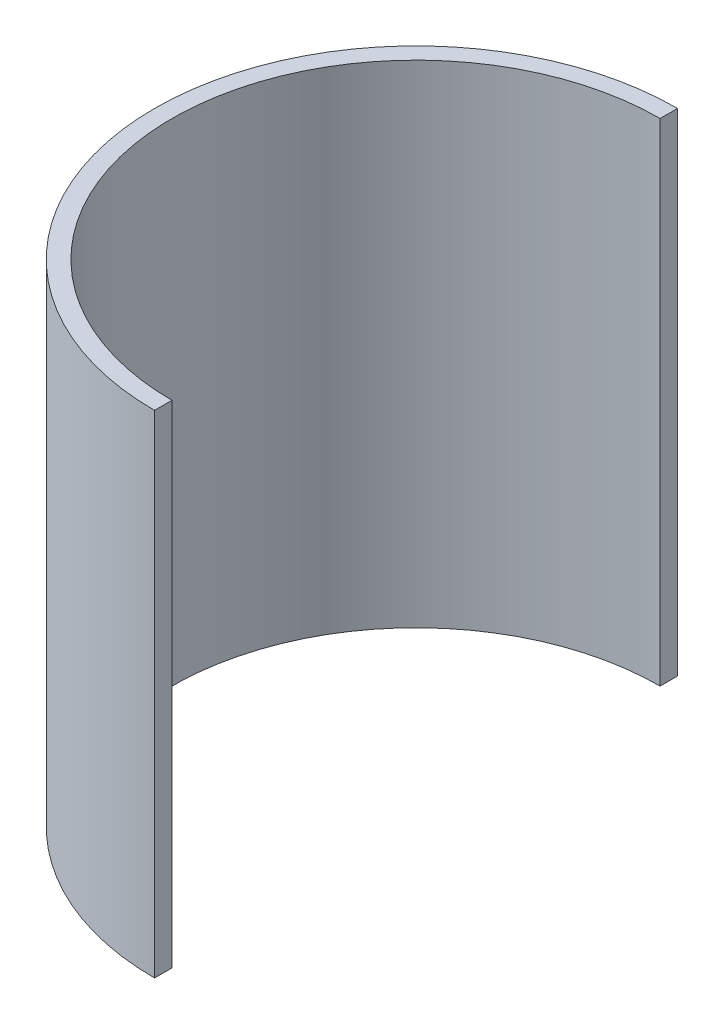
from build123d import *

# Parameters (mm, degrees)
BOSS_EXTRUDE1_DEPTH = 282


with BuildPart() as part:
    # Sketch2 → Boss-Extrude1 (new body)
    with BuildSketch(Plane(origin=(0, 0, 0), x_dir=(1, 0, 0), z_dir=(0, 1, 0))):
        with BuildLine():
            Line((0, 140), (0, 150))
            ThreePointArc((0, 150), (-150, 0), (0, -150))
            Line((0, -150), (0, -140))
            ThreePointArc((0, -140), (-140, 0), (0, 140))
        make_face()
    extrude(amount=BOSS_EXTRUDE1_DEPTH)


solid = part.part
